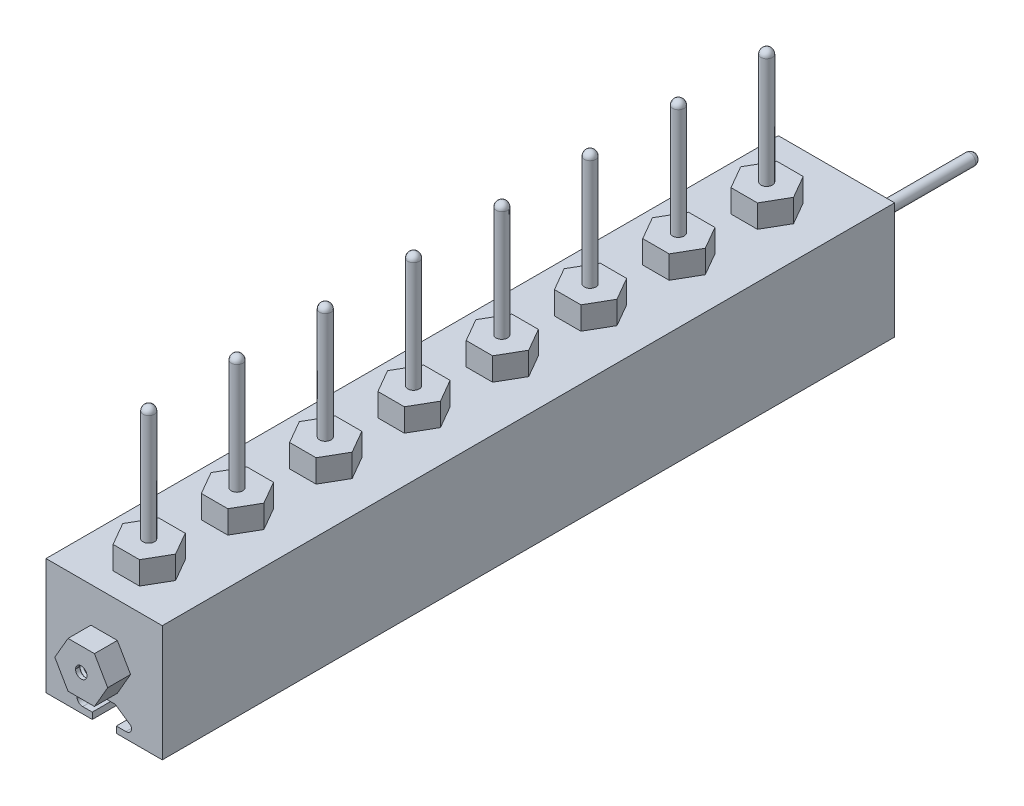
from build123d import *
from build123d.topology import SkipClean

# Parameters (mm, degrees)
SKETCH1_W               = 25.4
SKETCH1_H               = 160
BOSS_EXTRUDE1_DEPTH     = 25.4
BOSS_EXTRUDE2_DEPTH     = 5
LPATTERN1_COUNT         = 8
LPATTERN1_PITCH         = 19.285714286
BOSS_EXTRUDE3_DEPTH     = 5
BOSS_EXTRUDE4_DEPTH     = 5
CUT_EXTRUDE1_DEPTH      = 169.257094947
CUT_EXTRUDE1_DEPTH_BACK = 169.257094947
FILLET1_R               = 1.27
FILLET2_R               = 0.762
FILLET3_R               = 0.762
SKETCH9_R               = 1.25
BOSS_EXTRUDE5_DEPTH     = 25.4
FILLET4_R               = 1.25
LPATTERN2_COUNT         = 8
LPATTERN2_PITCH         = 19.285714286
FILLET5_R               = 1.25
SKETCH10_R              = 1.25
BOSS_EXTRUDE6_DEPTH     = 25.4
FILLET6_R               = 1.25
SKETCH11_R              = 1.25
CUT_EXTRUDE2_DEPTH      = 25.4
THREAD1_PITCH           = 1


with BuildPart() as part:
    # Sketch1 → Boss-Extrude1 (new body)
    with BuildSketch(Plane(origin=(0, 0, 0), x_dir=(1, 0, 0), z_dir=(0, 1, 0))):
        Rectangle(SKETCH1_W, SKETCH1_H)
    extrude(amount=BOSS_EXTRUDE1_DEPTH)

    # Sketch2 → Boss-Extrude2 (add)
    with BuildSketch(Plane(origin=(0, 25.4, 0), x_dir=(1, 0, 0), z_dir=(0, 1, 0))):
        Polygon((5.612647335, 65), (2.725895989, 70), (-3.047606703, 70), (-5.934358049, 65), (-3.047606703, 60), (2.725895989, 60), align=None)
    boss_extrude2 = extrude(amount=BOSS_EXTRUDE2_DEPTH)

    # LPattern1: Boss-Extrude2 ×8
    with Locations(*[(0, 0, i * LPATTERN1_PITCH) for i in range(1, LPATTERN1_COUNT)]):
        add(boss_extrude2)

    # Sketch3 → Boss-Extrude3 (add)
    with BuildSketch(Plane(origin=(0, 0, -80), x_dir=(-1, 0, 0), z_dir=(0, 0, -1))):
        Polygon((-2.886751346, 7.700000033), (2.886751346, 7.700000033), (5.773502692, 12.700000033), (2.886751346, 17.700000033), (-2.886751346, 17.700000033), (-5.773502692, 12.700000033), align=None)
    extrude(amount=BOSS_EXTRUDE3_DEPTH)

    # Sketch4 → Boss-Extrude4 (add)
    with BuildSketch(Plane.XY.offset(80)):
        Polygon((5.773502692, 12.700000033), (2.886751346, 17.700000033), (-2.886751346, 17.700000033), (-5.773502692, 12.700000033), (-2.886751346, 7.700000033), (2.886751346, 7.700000033), align=None)
    extrude(amount=BOSS_EXTRUDE4_DEPTH)

    # Sketch8 → Cut-Extrude1 (cut, two sides: drawn at the far end of the back side and taken through both)
    with BuildSketch(Plane(origin=(0, 0, -80), x_dir=(-1, 0, 0), z_dir=(0, 0, -1)).offset(-CUT_EXTRUDE1_DEPTH_BACK)):
        Polygon((-2.667, 0), (-2.667, 1.399157722), (-6.037, 1.399157722), (-6.037, 2.899157722), (-2.422, 5.389915638), (2.348, 5.389915638), (5.963, 2.899157722), (5.963, 1.399157722), (2.593, 1.399157722), (2.593, 0), align=None)
    extrude(amount=CUT_EXTRUDE1_DEPTH + CUT_EXTRUDE1_DEPTH_BACK, mode=Mode.SUBTRACT)

    # Fillet1
    fillet1_edges = [part.edges().sort_by_distance(p)[0] for p in [
        (6.037, 1.399157722, 0),
        (-5.963, 1.399157722, 0),
    ]]
    fillet(fillet1_edges, radius=FILLET1_R)

    # Fillet2
    fillet2_edges = [part.edges().sort_by_distance(p)[0] for p in [
        (2.422, 5.389915638, 0),
        (-2.348, 5.389915638, 0),
    ]]
    fillet(fillet2_edges, radius=FILLET2_R)

    # Fillet3
    fillet3_edges = [part.edges().sort_by_distance(p)[0] for p in [
        (6.037, 2.899157722, 0),
        (-5.963, 2.899157722, 0),
    ]]
    fillet(fillet3_edges, radius=FILLET3_R)

    # Sketch9 → Boss-Extrude5 (add)
    with BuildSketch(Plane(origin=(0, 30.4, 0), x_dir=(1, 0, 0), z_dir=(0, 1, 0))):
        with Locations(Location((-0.255428899, 64.999999967, 0), (0, 0, 270))):
            Circle(SKETCH9_R)
    boss_extrude5 = extrude(amount=BOSS_EXTRUDE5_DEPTH)

    # Fillet4
    fillet4_edges = [part.edges().sort_by_distance(p)[0] for p in [
        (-0.255428899, 55.8, -66.249999967),
    ]]
    fillet(fillet4_edges, radius=FILLET4_R)

    # LPattern2: Boss-Extrude5 ×8
    with Locations(*[(0, 0, i * LPATTERN2_PITCH) for i in range(1, LPATTERN2_COUNT)]):
        add(boss_extrude5)

    # Fillet5
    fillet5_edges = [part.edges().sort_by_distance(p)[0] for p in [
        (-0.255428899, 55.8, -46.964285681),
        (-0.255428899, 55.8, -27.678571396),
        (-0.255428899, 55.8, -8.39285711),
        (-0.255428899, 55.8, 10.892857176),
        (-0.255428899, 55.8, 30.178571462),
        (-0.255428899, 55.8, 49.464285747),
        (-0.255428899, 55.8, 68.750000033),
    ]]
    fillet(fillet5_edges, radius=FILLET5_R)

    # Sketch10 → Boss-Extrude6 (add)
    with BuildSketch(Plane(origin=(0, 0, -85), x_dir=(-1, 0, 0), z_dir=(0, 0, -1))):
        with Locations((0, 12.700000033)):
            Circle(SKETCH10_R)
    extrude(amount=BOSS_EXTRUDE6_DEPTH)

    # Fillet6
    fillet6_edges = [part.edges().sort_by_distance(p)[0] for p in [
        (1.25, 12.700000033, -110.4),
    ]]
    fillet(fillet6_edges, radius=FILLET6_R)

    # Sketch11 → Cut-Extrude2 (cut)
    with BuildSketch(Plane.XY.offset(85)):
        with Locations((0, 12.700000033)):
            Circle(SKETCH11_R)
    extrude(amount=-CUT_EXTRUDE2_DEPTH, mode=Mode.SUBTRACT)

    # Thread1: the profile of Thread Profile1 profile screwed along a right-hand helix of 10 turns, 8 arcs to a turn; built about Z, then put on its axis
    with SkipClean():  # the faces are left unmerged after this step: merging them gives an invalid solid
        thread1_z = Axis((0, 0, 0), (0, 0, 1))
        thread1_corners = [(1.2497, 0, -0.000173205), (1.791265875, 0, 0.312499999), (1.791265875, 0, 0.437499999), (1.2497, 0, 0.750173202)]
        with BuildLine(mode=Mode.PRIVATE) as thread1_profile:
            Line(thread1_corners[0], thread1_corners[1])
            Line(thread1_corners[1], thread1_corners[2])
            Line(thread1_corners[2], thread1_corners[3])
            Line(thread1_corners[3], thread1_corners[0])
        thread1_cap = Face(thread1_profile.wire())
        thread1_turn_angles = [0, 22.5, 45, 67.5, 90, 112.5, 135, 157.5, 180, 202.5, 225, 247.5, 270, 292.5, 315, 337.5, 360]
        thread1_turn_weights = [1, 0.9238795325112867, 1, 0.9238795325112867, 1, 0.9238795325112867, 1, 0.9238795325112867, 1, 0.9238795325112867, 1, 0.9238795325112867, 1, 0.9238795325112867, 1, 0.9238795325112867, 1]
        thread1_turn_rails = [Edge.make_bspline([Vector(p[0], p[1], 0).rotate(thread1_z, thread1_turn_angles[k]) / thread1_turn_weights[k] + Vector(0, 0, p[2] + THREAD1_PITCH * thread1_turn_angles[k] / 360) for k in range(17)], [0, 0, 0, 1, 1, 2, 2, 3, 3, 4, 4, 5, 5, 6, 6, 7, 7, 8, 8, 8], 2, thread1_turn_weights) for p in thread1_corners]
        thread1_turn_sides = [Face.make_surface_from_curves(thread1_turn_rails[p[0]], thread1_turn_rails[p[1]]) for p in [(0, 1), (1, 2), (2, 3), (3, 0)]]
        thread1 = Plane(origin=(0, 12.700000033, 85), x_dir=(-1, 0, 0), z_dir=(0, 0, -1)) * Solid(Shell([*[p.moved(Location((0, 0, THREAD1_PITCH * i))) for i in range(10) for p in thread1_turn_sides], thread1_cap, thread1_cap.rotate(thread1_z, 3600).moved(Location((0, 0, THREAD1_PITCH * 3600 / 360)))]))
        add(thread1, mode=Mode.SUBTRACT)


solid = part.part
